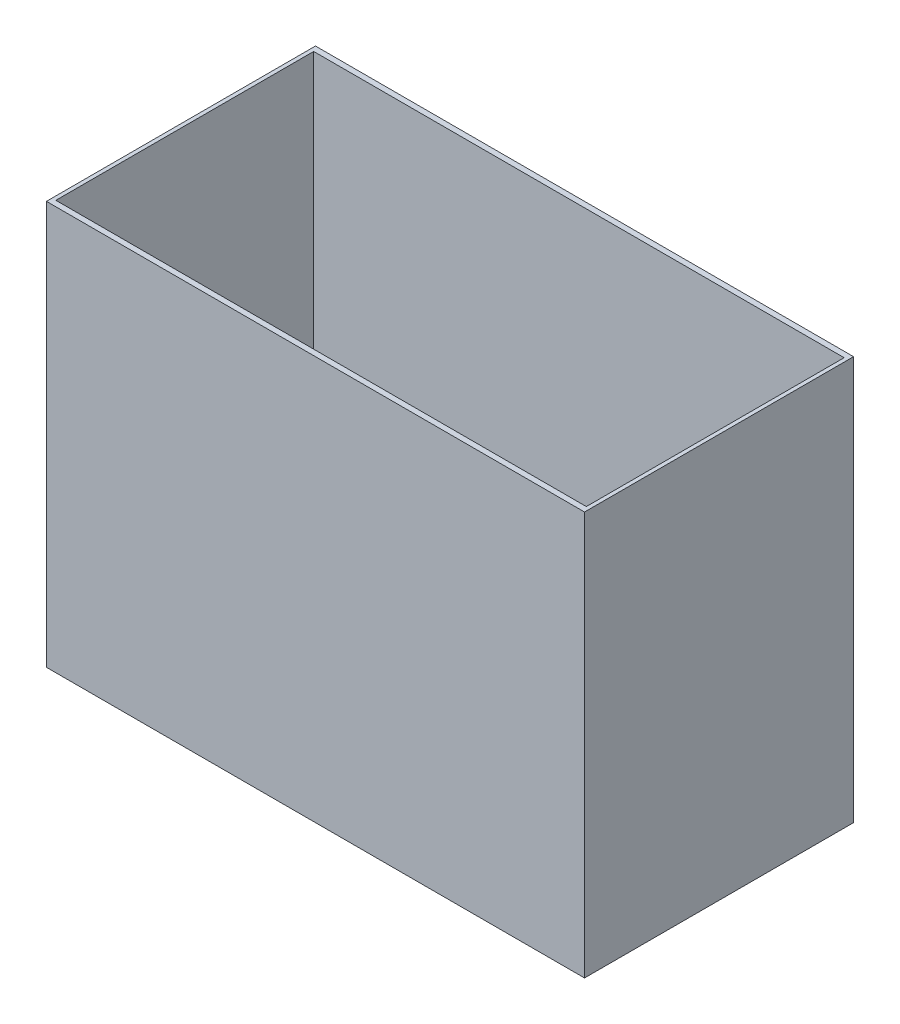
from build123d import *

# Parameters (mm, degrees)
SKETCH1_W           = 203.2
SKETCH1_H           = 279.4
BOSS_EXTRUDE1_DEPTH = 6.35
SKETCH3_W           = 609.6
SKETCH3_H           = 304.8
SKETCH3_W_2         = 600.964
SKETCH3_H_2         = 292.1
BOSS_EXTRUDE3_DEPTH = 457.2
SKETCH4_R           = 21.038100037
CUT_EXTRUDE1_DEPTH  = 566.15
SKETCH5_W           = 6.35
SKETCH5_H           = 25.4
CUT_EXTRUDE2_DEPTH  = 566.15
SKETCH6_R           = 21.038100037
CUT_EXTRUDE3_DEPTH  = 566.15
SKETCH7_W           = 6.477
SKETCH7_H           = 25.654
CUT_EXTRUDE4_DEPTH  = 566.15


with BuildPart() as part:
    # Sketch1 → Boss-Extrude1 (new body)
    with BuildSketch(Plane(origin=(0, 0, 0), x_dir=(1, 0, 0), z_dir=(0, 1, 0))):
        with Locations((190.5, 0)):
            Rectangle(SKETCH1_W, SKETCH1_H)
    extrude(amount=BOSS_EXTRUDE1_DEPTH)

    # Sketch4 → Cut-Extrude1 (cut, through all)
    with BuildSketch(Plane(origin=(0, 6.35, 0), x_dir=(1, 0, 0), z_dir=(0, 1, 0))):
        with Locations((252.011899963, 99.611899963)):
            Circle(SKETCH4_R)
    cut_extrude1 = extrude(amount=-CUT_EXTRUDE1_DEPTH, mode=Mode.SUBTRACT)

    # Mirror1: Cut-Extrude1 across plane
    add(cut_extrude1.mirror(Plane.XY), mode=Mode.SUBTRACT)

    # Sketch5 → Cut-Extrude2 (cut, through all)
    with BuildSketch(Plane(origin=(0, 6.35, 0), x_dir=(1, 0, 0), z_dir=(0, 1, 0))):
        with Locations((288.925, 30.48)):
            Rectangle(SKETCH5_W, SKETCH5_H)
        with Locations((288.925, 91.44)):
            Rectangle(SKETCH5_W, SKETCH5_H)
        with Locations((288.925, -91.44)):
            Rectangle(SKETCH5_W, SKETCH5_H)
        with Locations((288.925, -30.48)):
            Rectangle(SKETCH5_W, SKETCH5_H)
    extrude(amount=-CUT_EXTRUDE2_DEPTH, mode=Mode.SUBTRACT)

    # Sketch6 → Cut-Extrude3 (cut, through all)
    with BuildSketch(Plane(origin=(0, 6.35, 0), x_dir=(1, 0, 0), z_dir=(0, 1, 0))):
        with Locations((133.500264321, -46.186585501)):
            Circle(SKETCH6_R)
        with Locations((210.617612829, 12.193993268)):
            Circle(SKETCH6_R)
    extrude(amount=-CUT_EXTRUDE3_DEPTH, mode=Mode.SUBTRACT)

    # Sketch7 → Cut-Extrude4 (cut, through all)
    with BuildSketch(Plane(origin=(0, 6.35, 0), x_dir=(1, 0, 0), z_dir=(0, 1, 0))):
        with Locations((92.1385, 44.45)):
            Rectangle(SKETCH7_W, SKETCH7_H)
        with Locations((92.1385, -44.45)):
            Rectangle(SKETCH7_W, SKETCH7_H)
    extrude(amount=-CUT_EXTRUDE4_DEPTH, mode=Mode.SUBTRACT)


with BuildPart() as body_2:
    # Sketch3 → Boss-Extrude3 (new body)
    with BuildSketch(Plane(origin=(0, 0, 0), x_dir=(1, 0, 0), z_dir=(0, 1, 0))):
        Rectangle(SKETCH3_W, SKETCH3_H)
        Rectangle(SKETCH3_W_2, SKETCH3_H_2, mode=Mode.SUBTRACT)
    extrude(amount=BOSS_EXTRUDE3_DEPTH)


solid = Compound([part.part, body_2.part])
